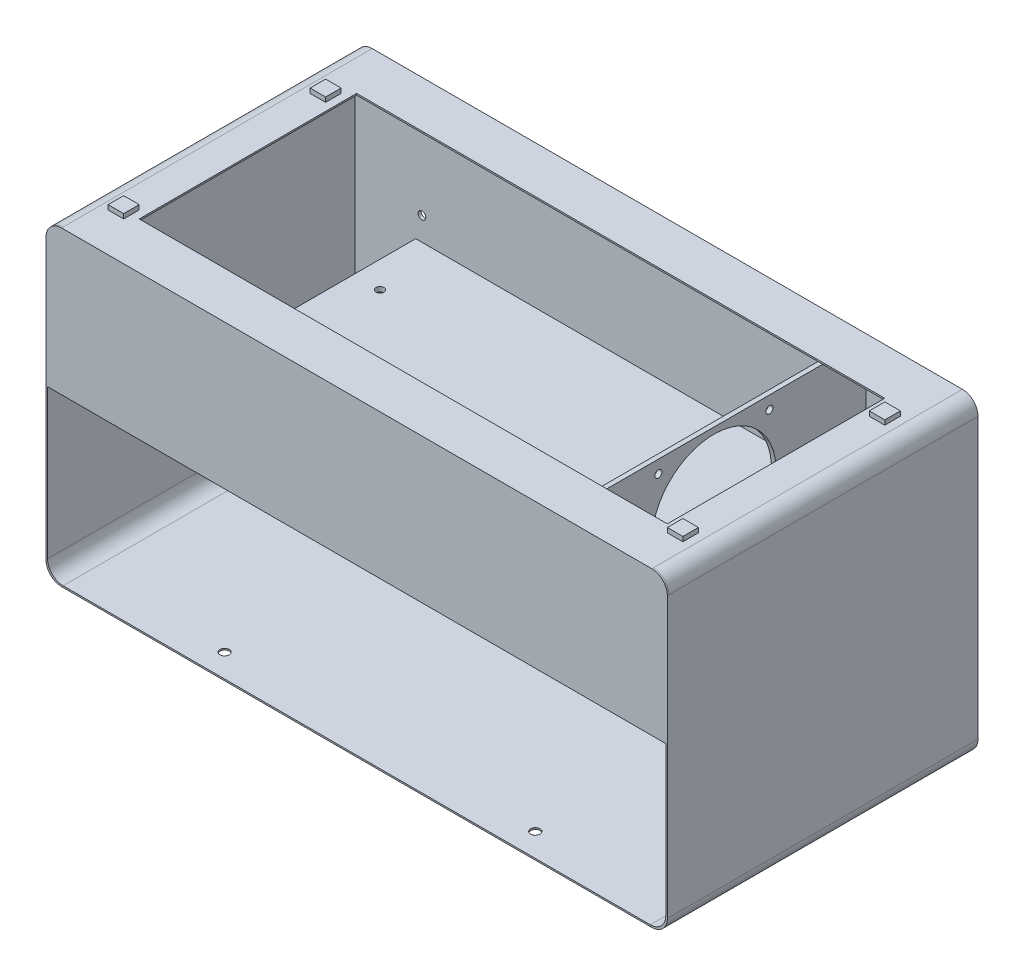
from build123d import *

# Parameters (mm, degrees)
SKETCH1_W                 = 400
SKETCH1_H                 = 200
KHUNG_TRONG_DEPTH         = 100
SKETCH2_W                 = 398
SKETCH2_H                 = 198
DO_DAY_1MM_DEPTH          = 198
FILLET_10MM_4_GOC_R       = 10
SKETCH3_W                 = 320
SKETCH3_H                 = 3
TRAN_GIA_DEPTH            = 198
SKETCH5_W                 = 3
SKETCH5_H                 = 198
GIA_DO_QUAT_DEPTH         = 89
SKETCH6_R                 = 40
LO_DAT_QUAT_DEPTH         = 3
SKETCH7_R                 = 2.3
CO_DINH_QUAT_DEPTH        = 3
SKETCH9_W                 = 20
SKETCH9_H                 = 20
LO_THONG_CHO_DEN_DEPTH    = 3
SKETCH10_R                = 2.6
GIA_DO_DEN_DEPTH          = 3
DAY_NGUON_DEN_QUAT_REACH  = 491.085
SKETCH12_R                = 5
DAY_NGUON_DEN_REACH       = 491.085
SKETCH13_R                = 2.5
F_2_THANH_RAY_TANG1_REACH = 459.822
SKETCH14_R                = 3
GAN_CAM_BIEN_REACH        = 491.085
SKETCH15_R                = 4.1
SKETCH16_W                = 340
SKETCH16_H                = 140
NAP_THAM_DEPTH            = 1
SKETCH18_W                = 399
SKETCH18_H                = 1
CHE_TRAN_DEPTH            = 93
FILLET4_R                 = 10
SKETCH19_W                = 10
SKETCH19_H                = 10
CHOT_CO_DINH_DEPTH        = 3


with BuildPart() as part:
    # Sketch1 → khung_trong (new, symmetric)
    with BuildSketch(Plane.XY):
        with Locations((200, 100)):
            Rectangle(SKETCH1_W, SKETCH1_H)
    extrude(amount=KHUNG_TRONG_DEPTH, both=True)

    # Sketch2 → do_day_1mm (cut)
    with BuildSketch(Plane.XY.offset(100)):
        with Locations((200, 100)):
            Rectangle(SKETCH2_W, SKETCH2_H)
    extrude(amount=-DO_DAY_1MM_DEPTH, mode=Mode.SUBTRACT)

    # Fillet_10mm_4_goc
    fillet_10mm_4_goc_edges = [part.edges().sort_by_distance(p)[0] for p in [
        (1, 1, 1),
        (1, 199, 1),
        (399, 199, 1),
        (399, 1, 1),
        (0, 200, 0),
        (400, 200, 0),
        (400, 0, 0),
        (0, 0, 0),
    ]]
    fillet(fillet_10mm_4_goc_edges, radius=FILLET_10MM_4_GOC_R)

    # Sketch3 → tran_gia (add)
    with BuildSketch(Plane.XY.offset(-98)):
        with Locations((200, 108.5)):
            Rectangle(SKETCH3_W, SKETCH3_H)
    extrude(amount=TRAN_GIA_DEPTH)

    # Sketch5 → gia_do_quat (add)
    with BuildSketch(Plane(origin=(0, 110, 0), x_dir=(1, 0, 0), z_dir=(0, 1, 0))):
        with Locations((328.5, -1)):
            Rectangle(SKETCH5_W, SKETCH5_H)
    extrude(amount=GIA_DO_QUAT_DEPTH)

    # Sketch6 → lo_dat_quat (cut)
    with BuildSketch(Plane.ZY.offset(-327)):
        with Locations((0, 155)):
            Circle(SKETCH6_R)
    extrude(amount=-LO_DAT_QUAT_DEPTH, mode=Mode.SUBTRACT)

    # Sketch7 → co_dinh_quat (cut)
    with BuildSketch(Plane.ZY.offset(-327)):
        with Locations((-35.75, 190.75)):
            Circle(SKETCH7_R)
        with Locations((35.75, 190.75)):
            Circle(SKETCH7_R)
        with Locations((35.75, 119.25)):
            Circle(SKETCH7_R)
        with Locations((-35.75, 119.25)):
            Circle(SKETCH7_R)
    extrude(amount=-CO_DINH_QUAT_DEPTH, mode=Mode.SUBTRACT)

    # Sketch9 → lo_thong_cho _den (cut)
    with BuildSketch(Plane.ZY.offset(-327)):
        with Locations((-58, 120)):
            Rectangle(SKETCH9_W, SKETCH9_H)
        with Locations((60, 120)):
            Rectangle(SKETCH9_W, SKETCH9_H)
    extrude(amount=-LO_THONG_CHO_DEN_DEPTH, mode=Mode.SUBTRACT)

    # Sketch10 → gia_do_den (cut)
    with BuildSketch(Plane(origin=(0, 110, 0), x_dir=(1, 0, 0), z_dir=(0, 1, 0))):
        with Locations(Location((337, 58, 0), (0, 0, 270))):
            Circle(SKETCH10_R)
        with Locations(Location((337, -60, 0), (0, 0, 270))):
            Circle(SKETCH10_R)
        with Locations(Location((57, 58, 0), (0, 0, 270))):
            Circle(SKETCH10_R)
        with Locations(Location((57, -60, 0), (0, 0, 270))):
            Circle(SKETCH10_R)
    extrude(amount=-GIA_DO_DEN_DEPTH, mode=Mode.SUBTRACT)

    # Sketch12 → day_nguon_den_quat (cut, up to next)
    with BuildSketch(Plane.XY.offset(-98), mode=Mode.PRIVATE) as day_nguon_den_quat_sk1:
        with Locations((344, 125)):
            Circle(SKETCH12_R)
    day_nguon_den_quat_tool1 = extrude(day_nguon_den_quat_sk1.sketch, amount=-DAY_NGUON_DEN_QUAT_REACH, mode=Mode.PRIVATE) & part.part
    add(day_nguon_den_quat_tool1.solids().sort_by_distance((344, 125, -98))[0], mode=Mode.SUBTRACT)

    # Sketch13 → day_nguon_den (cut, up to next)
    with BuildSketch(Plane.XY.offset(-98), mode=Mode.PRIVATE) as day_nguon_den_sk1:
        with Locations((44, 125)):
            Circle(SKETCH13_R)
    day_nguon_den_tool1 = extrude(day_nguon_den_sk1.sketch, amount=-DAY_NGUON_DEN_REACH, mode=Mode.PRIVATE) & part.part
    add(day_nguon_den_tool1.solids().sort_by_distance((44, 125, -98))[0], mode=Mode.SUBTRACT)

    # Sketch14 → 2_thanh_ray_tang1 (cut, up to next)
    with BuildSketch(Plane(origin=(0, 1, 0), x_dir=(1, 0, 0), z_dir=(0, 1, 0)), mode=Mode.PRIVATE) as f_2_thanh_ray_tang1_sk1:
        with Locations(Location((100, 85, 0), (0, 0, 270))):
            Circle(SKETCH14_R)
    f_2_thanh_ray_tang1_tool1 = extrude(f_2_thanh_ray_tang1_sk1.sketch, amount=-F_2_THANH_RAY_TANG1_REACH, mode=Mode.PRIVATE) & part.part
    # Sketch14 → 2_thanh_ray_tang1 (cut, up to next)
    with BuildSketch(Plane(origin=(0, 1, 0), x_dir=(1, 0, 0), z_dir=(0, 1, 0)), mode=Mode.PRIVATE) as f_2_thanh_ray_tang1_sk2:
        with Locations(Location((300, 85, 0), (0, 0, 270))):
            Circle(SKETCH14_R)
    f_2_thanh_ray_tang1_tool2 = extrude(f_2_thanh_ray_tang1_sk2.sketch, amount=-F_2_THANH_RAY_TANG1_REACH, mode=Mode.PRIVATE) & part.part
    # Sketch14 → 2_thanh_ray_tang1 (cut, up to next)
    with BuildSketch(Plane(origin=(0, 1, 0), x_dir=(1, 0, 0), z_dir=(0, 1, 0)), mode=Mode.PRIVATE) as f_2_thanh_ray_tang1_sk3:
        with Locations(Location((300, -85, 0), (0, 0, 270))):
            Circle(SKETCH14_R)
    f_2_thanh_ray_tang1_tool3 = extrude(f_2_thanh_ray_tang1_sk3.sketch, amount=-F_2_THANH_RAY_TANG1_REACH, mode=Mode.PRIVATE) & part.part
    # Sketch14 → 2_thanh_ray_tang1 (cut, up to next)
    with BuildSketch(Plane(origin=(0, 1, 0), x_dir=(1, 0, 0), z_dir=(0, 1, 0)), mode=Mode.PRIVATE) as f_2_thanh_ray_tang1_sk4:
        with Locations(Location((100, -85, 0), (0, 0, 270))):
            Circle(SKETCH14_R)
    f_2_thanh_ray_tang1_tool4 = extrude(f_2_thanh_ray_tang1_sk4.sketch, amount=-F_2_THANH_RAY_TANG1_REACH, mode=Mode.PRIVATE) & part.part
    add(f_2_thanh_ray_tang1_tool1.solids().sort_by_distance((100, 1, -85))[0], mode=Mode.SUBTRACT)
    add(f_2_thanh_ray_tang1_tool2.solids().sort_by_distance((300, 1, -85))[0], mode=Mode.SUBTRACT)
    add(f_2_thanh_ray_tang1_tool3.solids().sort_by_distance((300, 1, 85))[0], mode=Mode.SUBTRACT)
    add(f_2_thanh_ray_tang1_tool4.solids().sort_by_distance((100, 1, 85))[0], mode=Mode.SUBTRACT)

    # Sketch15 → gan_cam_bien (cut, up to next)
    with BuildSketch(Plane.XY.offset(-98), mode=Mode.PRIVATE) as gan_cam_bien_sk1:
        with Locations((121, 61)):
            Circle(SKETCH15_R)
    gan_cam_bien_tool1 = extrude(gan_cam_bien_sk1.sketch, amount=-GAN_CAM_BIEN_REACH, mode=Mode.PRIVATE) & part.part
    # Sketch15 → gan_cam_bien (cut, up to next)
    with BuildSketch(Plane.XY.offset(-98), mode=Mode.PRIVATE) as gan_cam_bien_sk2:
        with Locations((201, 61)):
            Circle(SKETCH15_R)
    gan_cam_bien_tool2 = extrude(gan_cam_bien_sk2.sketch, amount=-GAN_CAM_BIEN_REACH, mode=Mode.PRIVATE) & part.part
    # Sketch15 → gan_cam_bien (cut, up to next)
    with BuildSketch(Plane.XY.offset(-98), mode=Mode.PRIVATE) as gan_cam_bien_sk3:
        with Locations((281, 61)):
            Circle(SKETCH15_R)
    gan_cam_bien_tool3 = extrude(gan_cam_bien_sk3.sketch, amount=-GAN_CAM_BIEN_REACH, mode=Mode.PRIVATE) & part.part
    add(gan_cam_bien_tool1.solids().sort_by_distance((121, 61, -98))[0], mode=Mode.SUBTRACT)
    add(gan_cam_bien_tool2.solids().sort_by_distance((201, 61, -98))[0], mode=Mode.SUBTRACT)
    add(gan_cam_bien_tool3.solids().sort_by_distance((281, 61, -98))[0], mode=Mode.SUBTRACT)

    # Sketch16 → nap_tham (cut)
    with BuildSketch(Plane(origin=(0, 200, 0), x_dir=(1, 0, 0), z_dir=(0, 1, 0))):
        with Locations((200, 0)):
            Rectangle(SKETCH16_W, SKETCH16_H)
    extrude(amount=-NAP_THAM_DEPTH, mode=Mode.SUBTRACT)

    # Sketch18 → che_tran (add)
    with BuildSketch(Plane.XZ.offset(-107)):
        with Locations((200.5, 99.5)):
            Rectangle(SKETCH18_W, SKETCH18_H)
    extrude(amount=-CHE_TRAN_DEPTH)

    # Fillet4
    # the kernel refuses this fillet: 10 mm, written as the material it takes off along each edge
    with BuildSketch(Plane(origin=(400, 200, 125), x_dir=(-1, 0, 0), z_dir=(0, 0, -1))) as fillet4_piece_1:
        with BuildLine():
            CenterArc((FILLET4_R, -FILLET4_R), FILLET4_R, 90, 90)
            Line((0, -FILLET4_R), (-FILLET4_R * 0.02, -FILLET4_R))
            Line((-FILLET4_R * 0.02, -FILLET4_R), (-FILLET4_R * 0.02, FILLET4_R * 0.02))
            Line((-FILLET4_R * 0.02, FILLET4_R * 0.02), (FILLET4_R, FILLET4_R * 0.02))
            Line((FILLET4_R, FILLET4_R * 0.02), (FILLET4_R, 0))
        make_face()
    extrude(amount=51, mode=Mode.SUBTRACT)
    with BuildSketch(Plane(origin=(1, 200, 76.5), x_dir=(1, 0, 0), z_dir=(0, 0, 1))) as fillet4_piece_2:
        with BuildLine():
            CenterArc((9, -10), FILLET4_R, 90, 64.158067237)
            Line((0, -5.641101056), (-0.18, -5.553923078))
            ThreePointArc((-0.18, -5.553923078), (-0.2, -2.820550528), (-0.2, 0))
            Line((-0.2, 0), (0, 0.2))
            Line((0, 0.2), (9, 0.2))
            Line((9, 0.2), (9, 0))
        make_face()
    extrude(amount=46, mode=Mode.SUBTRACT)

    # Sketch19 → chot_co_dinh (add)
    with BuildSketch(Plane(origin=(0, 200, 0), x_dir=(1, 0, 0), z_dir=(0, 1, 0))):
        with Locations((20, 60)):
            Rectangle(SKETCH19_W, SKETCH19_H)
        with Locations((380, 60)):
            Rectangle(SKETCH19_W, SKETCH19_H)
        with Locations((380, -70)):
            Rectangle(SKETCH19_W, SKETCH19_H)
        with Locations((20, -70)):
            Rectangle(SKETCH19_W, SKETCH19_H)
    extrude(amount=CHOT_CO_DINH_DEPTH)


solid = part.part
